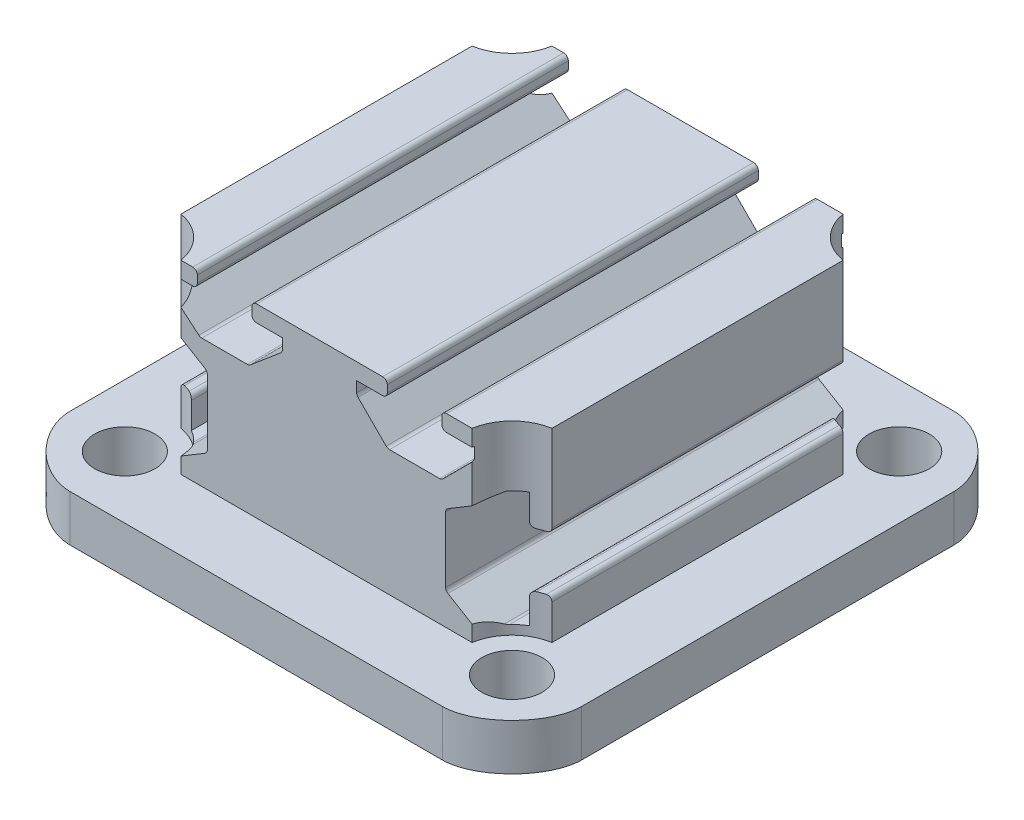
from build123d import *

# Parameters (mm, degrees)
SKETCH1_W               = 55.14
SKETCH1_H               = 55.14
BOSS_EXTRUDE1_DEPTH     = 5
SKETCH2_R               = 3.25
CUT_EXTRUDE1_DEPTH      = 40.309156694
FILLET1_SIZE            = 7.5
SKETCH3_W               = 40
SKETCH3_H               = 40
BOSS_EXTRUDE2_DEPTH     = 20
CUT_EXTRUDE2_DEPTH      = 44.820198665
CUT_EXTRUDE2_DEPTH_BACK = 44.820198665
SKETCH2_2_R             = 3.25
SKETCH5_R               = 5.25
CUT_EXTRUDE3_DEPTH      = 20
CUT_EXTRUDE5_DEPTH      = 61.398756734
FILLET5_R               = 0.5
CUT_EXTRUDE6_DEPTH      = 61.398756776
FILLET6_R               = 0.5
CUT_EXTRUDE7_DEPTH      = 61.398756776
FILLET7_R               = 0.5


with BuildPart() as part:
    # Sketch1 → Boss-Extrude1 (new body)
    with BuildSketch(Plane(origin=(0, 0, 0), x_dir=(1, 0, 0), z_dir=(0, 1, 0))):
        Rectangle(SKETCH1_W, SKETCH1_H)
    extrude(amount=BOSS_EXTRUDE1_DEPTH)

    # Sketch2 → Cut-Extrude1 (cut, through all)
    with BuildSketch(Plane(origin=(0, 5, 0), x_dir=(1, 0, 0), z_dir=(0, 1, 0))):
        with Locations(Location((20.87, -20.87, 0), (0, 0, 270))):
            Circle(SKETCH2_R)
        with Locations(Location((-20.87, -20.87, 0), (0, 0, 270))):
            Circle(SKETCH2_R)
        with Locations(Location((-20.87, 20.87, 0), (0, 0, 270))):
            Circle(SKETCH2_R)
        with Locations(Location((20.87, 20.87, 0), (0, 0, 270))):
            Circle(SKETCH2_R)
    extrude(amount=-CUT_EXTRUDE1_DEPTH, mode=Mode.SUBTRACT)

    # Fillet1
    # a fillet whose section is not a circle: 7.5 mm, written as the material it takes off along each edge
    with BuildSketch(Plane(origin=(-27.57, -18.75, -27.57), x_dir=(0, 0, 1), z_dir=(0, 1, 0)), Plane(origin=(-27.57, -18.75, 27.57), x_dir=(1, 0, 0), z_dir=(0, 1, 0))) as fillet1_piece_1:
        with BuildLine():
            Bezier((FILLET1_SIZE, 0), (0, 0), (0, FILLET1_SIZE), weights=[1, 0.530330086, 1])
            Line((0, FILLET1_SIZE), (0, 0))
            Line((0, 0), (FILLET1_SIZE, 0))
        make_face()
    extrude(amount=42.5, mode=Mode.SUBTRACT)
    with BuildSketch(Plane(origin=(27.57, -18.75, 27.57), x_dir=(-1, 0, 0), z_dir=(0, 1, 0)), Plane(origin=(27.57, -18.75, -27.57), x_dir=(0, 0, 1), z_dir=(0, 1, 0))) as fillet1_piece_2:
        with BuildLine():
            Bezier((FILLET1_SIZE, 0), (0, 0), (0, -FILLET1_SIZE), weights=[1, 0.530330086, 1])
            Line((0, -FILLET1_SIZE), (0, 0))
            Line((0, 0), (FILLET1_SIZE, 0))
        make_face()
    extrude(amount=42.5, mode=Mode.SUBTRACT)

    # Sketch3 → Boss-Extrude2 (add)
    with BuildSketch(Plane(origin=(0, 5, 0), x_dir=(1, 0, 0), z_dir=(0, 1, 0))):
        Rectangle(SKETCH3_W, SKETCH3_H)
    extrude(amount=BOSS_EXTRUDE2_DEPTH)

    # Sketch2<2> → Cut-Extrude2 (cut, two sides: drawn at the far end of the back side and taken through both)
    with BuildSketch(Plane(origin=(0, 5, 0), x_dir=(1, 0, 0), z_dir=(0, 1, 0)).offset(-CUT_EXTRUDE2_DEPTH_BACK)):
        with Locations(Location((20.87, -20.87, 0), (0, 0, 270))):
            Circle(SKETCH2_2_R)
        with Locations(Location((-20.87, -20.87, 0), (0, 0, 270))):
            Circle(SKETCH2_2_R)
        with Locations(Location((-20.87, 20.87, 0), (0, 0, 270))):
            Circle(SKETCH2_2_R)
        with Locations(Location((20.87, 20.87, 0), (0, 0, 270))):
            Circle(SKETCH2_2_R)
    extrude(amount=CUT_EXTRUDE2_DEPTH + CUT_EXTRUDE2_DEPTH_BACK, mode=Mode.SUBTRACT)

    # Sketch5 → Cut-Extrude3 (cut)
    with BuildSketch(Plane(origin=(0, 5, 0), x_dir=(1, 0, 0), z_dir=(0, 1, 0))):
        with Locations((-20.87, 20.87)):
            Circle(SKETCH5_R)
        with Locations((20.87, 20.87)):
            Circle(SKETCH5_R)
        with Locations((-20.87, -20.87)):
            Circle(SKETCH5_R)
        with Locations((20.87, -20.87)):
            Circle(SKETCH5_R)
    extrude(amount=CUT_EXTRUDE3_DEPTH, mode=Mode.SUBTRACT)

    # Sketch8 → Cut-Extrude5 (cut, through all)
    with BuildSketch(Plane.XY.offset(20)):
        Polygon((-13.925817609, 25), (-13.925817609, 23.23), (-17.225817609, 23.23), (-17.225817609, 21.89), (-13.62081761, 18.858816238), (-8.350817609, 18.858816238), (-4.74581761, 21.89), (-4.74581761, 23.23), (-8.04581761, 23.23), (-8.04581761, 25), align=None)
        Polygon((6.55418239, 25), (6.55418239, 23.23), (3.25418239, 23.23), (3.25418239, 21.89), (6.58465533, 18.559527061), (12.403709451, 18.559527061), (15.73418239, 21.89), (15.73418239, 23.23), (12.43418239, 23.23), (12.43418239, 25), align=None)
    extrude(amount=-CUT_EXTRUDE5_DEPTH, mode=Mode.SUBTRACT)

    # Fillet5
    fillet5_edges = [part.edges().sort_by_distance(p)[0] for p in [
        (15.73418239, 21.89, 0),
        (3.25418239, 21.89, 0),
        (12.403709451, 18.559527061, 0),
        (6.58465533, 18.559527061, 0),
        (6.55418239, 25, 0),
        (6.55418239, 23.23, 0),
        (12.43418239, 23.23, 0),
        (12.43418239, 25, 0),
        (-8.04581761, 25, 0),
        (-8.04581761, 23.23, 0),
        (-4.74581761, 21.89, 0),
        (-8.350817609, 18.858816238, 0),
        (-13.62081761, 18.858816238, 0),
        (-17.225817609, 21.89, 0),
        (-13.925817609, 23.23, 0),
        (-13.925817609, 25, 0),
    ]]
    fillet(fillet5_edges, radius=FILLET5_R)

    # Sketch10 → Cut-Extrude6 (cut, through all)
    with BuildSketch(Plane(origin=(0, 0, -20), x_dir=(-1, 0, 0), z_dir=(0, 0, -1))):
        Polygon((20, 15.18), (18.23, 15.18), (18.23, 18.48), (16.89, 18.48), (12.85120832, 16.056724992), (12.85120832, 8.423275008), (16.89, 6), (18.23, 6), (18.23, 9.3), (20, 9.3), align=None)
    extrude(amount=-CUT_EXTRUDE6_DEPTH, mode=Mode.SUBTRACT)

    # Fillet6
    fillet6_edges = [part.edges().sort_by_distance(p)[0] for p in [
        (-18.23, 15.18, 0),
        (-20, 15.18, 0),
        (-20, 9.3, 0),
        (-18.23, 9.3, 0),
        (-16.89, 6, 0),
        (-16.89, 18.48, 0),
        (-12.85120832, 8.423275008, 0),
        (-12.85120832, 16.056724992, 0),
    ]]
    fillet(fillet6_edges, radius=FILLET6_R)

    # Sketch11 → Cut-Extrude7 (cut, through all)
    with BuildSketch(Plane(origin=(0, 0, -20), x_dir=(-1, 0, 0), z_dir=(0, 0, -1))):
        Polygon((-20, 9.3), (-18.23, 9.3), (-18.23, 6), (-16.89, 6), (-12.85120832, 8.423275008), (-12.85120832, 16.056724992), (-16.89, 18.48), (-18.23, 18.48), (-18.23, 15.18), (-20, 15.18), align=None)
    extrude(amount=-CUT_EXTRUDE7_DEPTH, mode=Mode.SUBTRACT)

    # Fillet7
    fillet7_edges = [part.edges().sort_by_distance(p)[0] for p in [
        (12.85120832, 8.423275008, 0),
        (12.85120832, 16.056724992, 0),
        (16.89, 18.48, 0),
        (16.89, 6, 0),
        (18.23, 9.3, 0),
        (20, 9.3, 0),
        (20, 15.18, 0),
        (18.23, 15.18, 0),
    ]]
    fillet(fillet7_edges, radius=FILLET7_R)


solid = part.part
